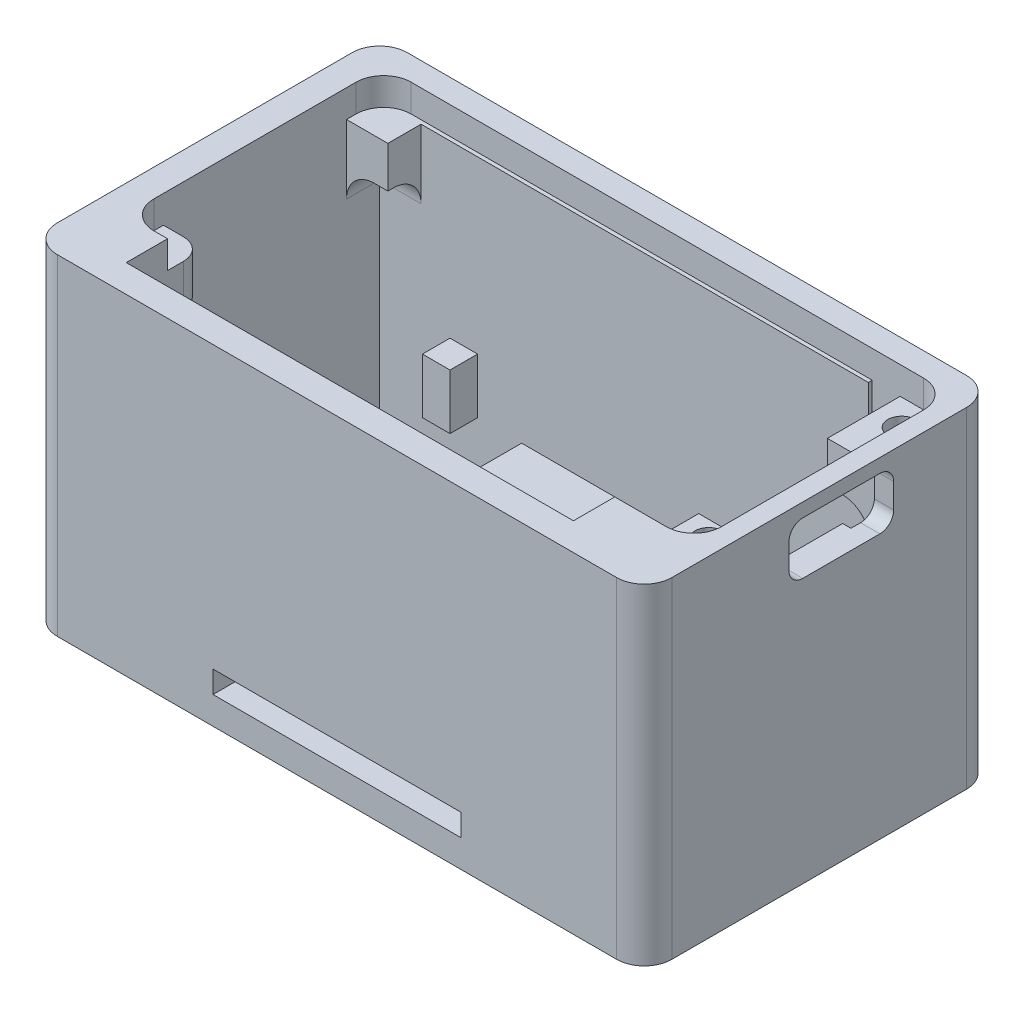
from build123d import *

# Parameters (mm, degrees)
SKETCH1_W           = 56.642
SKETCH1_H           = 32.258
BOSS_EXTRUDE1_DEPTH = 30.48
SHELL1_T            = -2.54
BOSS_EXTRUDE2_DEPTH = 6.35
FILLET2_R           = 2.54
FILLET3_R           = 2.54
CUT_EXTRUDE9_REACH  = 54.647
SKETCH10_W          = 22.86
SKETCH10_H          = 2.032
BOSS_EXTRUDE3_REACH = 46.623
SKETCH13_W          = 2.54
SKETCH13_H          = 3.81
SKETCH14_W          = 3.81
SKETCH14_H          = 1.27
BOSS_EXTRUDE4_DEPTH = 25.4
CUT_EXTRUDE10_DEPTH = 2.54
CUT_EXTRUDE11_REACH = 46.623
SKETCH16_W          = 9.652
SKETCH16_H          = 4.826
SKETCH11_R          = 1.27
CUT_EXTRUDE12_DEPTH = 9.398
MIRROR2_START       = 4.572
MIRROR2_OUTLINE_W   = 25.4
MIRROR2_OUTLINE_H   = 3.81
MIRROR2_DEPTH       = 2.54
SKETCH17_W          = 2.54
SKETCH17_H          = 3.81
CUT_EXTRUDE13_DEPTH = 23.368
SKETCH18_W          = 7.2898
SKETCH18_H          = 2.54
CUT_EXTRUDE14_DEPTH = 7.366
FILLET4_R           = 1.27
SKETCH19_W          = 2.54
SKETCH19_H          = 5.08
BOSS_EXTRUDE5_DEPTH = 2.54
CUT_EXTRUDE15_START = -23.368
SKETCH20_W          = 2.54
SKETCH20_H          = 3.81
CUT_EXTRUDE15_DEPTH = 23.368
SKETCH22_W          = 2.657331224
SKETCH22_H          = 5.08
CUT_EXTRUDE18_DEPTH = 6.858
SKETCH23_W          = 2.581688451
SKETCH23_H          = 6.7056
CUT_EXTRUDE19_DEPTH = 6.858
SKETCH24_W          = 4.254264989
SKETCH24_H          = 4.461970644
CUT_EXTRUDE20_DEPTH = 7.112


# Read off the part's stored shape, not the designer's step: Mirror2
with BuildPart() as part:
    # Sketch1 → Boss-Extrude1 (new body)
    with BuildSketch(Plane(origin=(0, 0, 0), x_dir=(1, 0, 0), z_dir=(0, 1, 0))):
        Rectangle(SKETCH1_W, SKETCH1_H)
    extrude(amount=BOSS_EXTRUDE1_DEPTH)

    # Shell1
    shell1_openings = [part.faces().sort_by_distance(p)[0] for p in [
        (0, 30.48, 0),
    ]]
    offset(amount=SHELL1_T, openings=shell1_openings, kind=Kind.INTERSECTION)

    # Sketch3 → Boss-Extrude2 (add)
    with BuildSketch(Plane(origin=(0, 30.48, 0), x_dir=(1, 0, 0), z_dir=(0, 1, 0))):
        with BuildLine():
            Line((-25.781, 13.589), (-25.781, 6.35))
            Line((-25.781, 6.35), (-23.9268, 6.35))
            ThreePointArc((-23.9268, 6.35), (-22.543840557, 6.922840557), (-21.971, 8.3058))
            Line((-21.971, 8.3058), (-21.971, 13.589))
            Line((-21.971, 13.589), (-25.781, 13.589))
        make_face()
        with BuildLine():
            Line((-21.971, -13.589), (-21.971, -8.3058))
            ThreePointArc((-21.971, -8.3058), (-22.543840557, -6.922840557), (-23.9268, -6.35))
            Line((-23.9268, -6.35), (-25.781, -6.35))
            Line((-25.781, -6.35), (-25.781, -13.589))
            Line((-25.781, -13.589), (-21.971, -13.589))
        make_face()
        with BuildLine():
            Line((25.781, 13.589), (19.2532, 13.589))
            Line((19.2532, 13.589), (19.2532, 5.969))
            ThreePointArc((19.2532, 5.969), (19.625174388, 5.070974388), (20.5232, 4.699))
            Line((20.5232, 4.699), (25.781, 4.699))
            Line((25.781, 4.699), (25.781, 13.589))
        make_face()
        with BuildLine():
            Line((25.781, -4.699), (25.781, -13.589))
            Line((25.781, -13.589), (19.2532, -13.589))
            Line((19.2532, -13.589), (19.2532, -5.969))
            ThreePointArc((19.2532, -5.969), (19.625174388, -5.070974388), (20.5232, -4.699))
            Line((20.5232, -4.699), (25.781, -4.699))
        make_face()
    extrude(amount=-BOSS_EXTRUDE2_DEPTH)

    # Fillet2
    fillet2_edges = [part.edges().sort_by_distance(p)[0] for p in [
        (28.321, 15.24, 16.129),
        (-28.321, 15.24, 16.129),
        (-28.321, 15.24, -16.129),
        (28.321, 15.24, -16.129),
    ]]
    fillet(fillet2_edges, radius=FILLET2_R)

    # Fillet3
    fillet3_edges = [part.edges().sort_by_distance(p)[0] for p in [
        (-25.781, 24.13, 9.9695),
        (-23.876, 24.13, 13.589),
        (22.5171, 24.13, 13.589),
        (25.781, 24.13, 9.144),
        (-23.876, 24.13, -13.589),
        (-25.781, 24.13, -9.9695),
        (22.5171, 24.13, -13.589),
        (25.781, 24.13, -9.144),
    ]]
    fillet(fillet3_edges, radius=FILLET3_R)

    # Cut-Extrude9: up to this face of the body (flat: up to its plane)
    cut_extrude9_end = Plane(part.part.faces().sort_by_distance((0, 15.24, 16.129))[0])
    # Sketch10 → Cut-Extrude9 (cut, up to the picked face)
    with BuildSketch(Plane(origin=(0, 0, -16.129), x_dir=(-1, 0, 0), z_dir=(0, 0, -1)), mode=Mode.PRIVATE) as cut_extrude9_sk1:
        with Locations((0, 3.556)):
            Rectangle(SKETCH10_W, SKETCH10_H)
    cut_extrude9_tool1 = split(extrude(cut_extrude9_sk1.sketch, amount=-CUT_EXTRUDE9_REACH, mode=Mode.PRIVATE), bisect_by=cut_extrude9_end, keep=Keep.BOTH, mode=Mode.PRIVATE)
    add(cut_extrude9_tool1.solids().sort_by(Axis((0, 3.556, -16.129), (0, 0, 1)))[0], mode=Mode.SUBTRACT)

    # Sketch13 → Boss-Extrude3 (add, up to next)
    with BuildSketch(Plane(origin=(0, 30.48, 0), x_dir=(1, 0, 0), z_dir=(0, 1, 0)), mode=Mode.PRIVATE) as boss_extrude3_sk1:
        with Locations((-13.97, -11.684)):
            Rectangle(SKETCH13_W, SKETCH13_H)
    boss_extrude3_tool1 = extrude(boss_extrude3_sk1.sketch, amount=-BOSS_EXTRUDE3_REACH, mode=Mode.PRIVATE) - part.part
    boss_extrude3 = boss_extrude3_tool1.solids().sort_by_distance((-13.97, 30.48, 11.684))[0]
    add(boss_extrude3)

    # Mirror1: Boss-Extrude3 across plane
    add(boss_extrude3.mirror(Plane(origin=(0, 0, 0), x_dir=(0, 0, 1), z_dir=(1, 0, 0))))

    # Sketch14 → Boss-Extrude4 (add)
    with BuildSketch(Plane.ZY.offset(-12.7)):
        with Locations((11.684, 5.207)):
            Rectangle(SKETCH14_W, SKETCH14_H)
    extrude(amount=BOSS_EXTRUDE4_DEPTH)

    # Sketch15 → Cut-Extrude10 (cut)
    with BuildSketch(Plane(origin=(0, 30.48, 0), x_dir=(1, 0, 0), z_dir=(0, 1, 0))):
        with BuildLine():
            Line((-25.781, 11.4046), (-25.781, 6.35))
            Line((-25.781, 6.35), (-23.9268, 6.35))
            ThreePointArc((-23.9268, 6.35), (-22.543840557, 6.922840557), (-21.971, 8.3058))
            Line((-21.971, 8.3058), (-21.971, 13.589))
            Line((-21.971, 13.589), (19.2532, 13.589))
            Line((19.2532, 13.589), (19.2532, 5.969))
            ThreePointArc((19.2532, 5.969), (19.625174388, 5.070974388), (20.5232, 4.699))
            Line((20.5232, 4.699), (25.781, 4.699))
            Line((25.781, 4.699), (25.781, -4.699))
            Line((25.781, -4.699), (20.5232, -4.699))
            ThreePointArc((20.5232, -4.699), (19.625174388, -5.070974388), (19.2532, -5.969))
            Line((19.2532, -5.969), (19.2532, -9.779))
            Line((19.2532, -9.779), (24.003, -9.779))
            ThreePointArc((24.003, -9.779), (25.799051224, -9.035051224), (26.543, -7.239))
            Line((26.543, -7.239), (26.543, -1.000588636))
            Line((26.543, -1.000588636), (26.543, 5.166188636))
            Line((26.543, 5.166188636), (26.543, 11.4046))
            ThreePointArc((26.543, 11.4046), (25.799051224, 13.200651224), (24.003, 13.9446))
            Line((24.003, 13.9446), (-23.241, 13.9446))
            ThreePointArc((-23.241, 13.9446), (-25.037051224, 13.200651224), (-25.781, 11.4046))
        make_face()
        with BuildLine():
            Line((-25.781, -6.35), (-25.781, -7.239))
            ThreePointArc((-25.781, -7.239), (-25.037051224, -9.035051224), (-23.241, -9.779))
            Line((-23.241, -9.779), (-21.971, -9.779))
            Line((-21.971, -9.779), (-21.971, -8.3058))
            ThreePointArc((-21.971, -8.3058), (-22.543840557, -6.922840557), (-23.9268, -6.35))
            Line((-23.9268, -6.35), (-25.781, -6.35))
        make_face()
    extrude(amount=-CUT_EXTRUDE10_DEPTH, mode=Mode.SUBTRACT)

    # Cut-Extrude11: up to this face of the body (flat: up to its plane)
    cut_extrude11_end = Plane(part.part.faces().sort_by_distance((28.321, 15.24, 0))[0])
    # Sketch16 → Cut-Extrude11 (cut, up to the picked face)
    with BuildSketch(Plane(origin=(0, 0, 0), x_dir=(0, 0, -1), z_dir=(1, 0, 0)), mode=Mode.PRIVATE) as cut_extrude11_sk1:
        with Locations((2.032, 26.797)):
            Rectangle(SKETCH16_W, SKETCH16_H)
    cut_extrude11_tool1 = split(extrude(cut_extrude11_sk1.sketch, amount=CUT_EXTRUDE11_REACH, mode=Mode.PRIVATE), bisect_by=cut_extrude11_end, keep=Keep.BOTH, mode=Mode.PRIVATE)
    add(cut_extrude11_tool1.solids().sort_by(Axis((0, 26.797, -2.032), (1, 0, 0)))[0], mode=Mode.SUBTRACT)

    # Sketch11 → Cut-Extrude12 (cut)
    with BuildSketch(Plane(origin=(0, 30.48, 0), x_dir=(1, 0, 0), z_dir=(0, 1, 0))):
        with Locations(Location((24.384, 11.5316, 0), (0, 0, 270))):
            Circle(SKETCH11_R)
        with Locations(Location((24.384, -6.2484, 0), (0, 0, 270))):
            Circle(SKETCH11_R)
    extrude(amount=-CUT_EXTRUDE12_DEPTH, mode=Mode.SUBTRACT)

    # Mirror2 outline → Mirror2 (add)
    with BuildSketch(Plane(origin=(0, 0, 0), x_dir=(1, 0, 0), z_dir=(0, 1, 0)).offset(MIRROR2_START)):
        with Locations((0, 11.684)):
            Rectangle(MIRROR2_OUTLINE_W, MIRROR2_OUTLINE_H)
        with Locations((0, -11.684)):
            Rectangle(MIRROR2_OUTLINE_W, MIRROR2_OUTLINE_H)
    extrude(amount=MIRROR2_DEPTH)

    # Sketch17 → Cut-Extrude13 (cut)
    with BuildSketch(Plane(origin=(0, 30.48, 0), x_dir=(1, 0, 0), z_dir=(0, 1, 0))):
        with Locations((-13.97, -11.684)):
            Rectangle(SKETCH17_W, SKETCH17_H)
    extrude(amount=-CUT_EXTRUDE13_DEPTH, mode=Mode.SUBTRACT)

    # Sketch18 → Cut-Extrude14 (cut)
    with BuildSketch(Plane(origin=(0, 27.94, 0), x_dir=(1, 0, 0), z_dir=(0, 1, 0))):
        with Locations((22.8981, 5.969)):
            Rectangle(SKETCH18_W, SKETCH18_H)
    extrude(amount=-CUT_EXTRUDE14_DEPTH, mode=Mode.SUBTRACT)

    # Fillet4
    fillet4_edges = [part.edges().sort_by_distance(p)[0] for p in [
        (27.432, 29.21, -6.858),
        (27.432, 24.384, -6.858),
        (27.051, 24.384, 2.794),
        (27.432, 29.21, 2.794),
    ]]
    fillet(fillet4_edges, radius=FILLET4_R)

    # Sketch19 → Boss-Extrude5 (add)
    with BuildSketch(Plane(origin=(0, 0, 13.589), x_dir=(-1, 0, 0), z_dir=(0, 0, -1))):
        with Locations((18.034, 9.652)):
            Rectangle(SKETCH19_W, SKETCH19_H)
    boss_extrude5 = extrude(amount=BOSS_EXTRUDE5_DEPTH)

    # Mirror3: Boss-Extrude5 across plane
    add(boss_extrude5.mirror(Plane.XY))

    # Sketch20 → Cut-Extrude15 (cut)
    with BuildSketch(Plane(origin=(0, 30.48, 0), x_dir=(1, 0, 0), z_dir=(0, 1, 0)).offset(CUT_EXTRUDE15_START)):
        with Locations((13.97, -11.684)):
            Rectangle(SKETCH20_W, SKETCH20_H)
    extrude(amount=CUT_EXTRUDE15_DEPTH, mode=Mode.SUBTRACT)

    # Sketch22 → Cut-Extrude18 (cut)
    with BuildSketch(Plane(origin=(0, 27.94, 0), x_dir=(1, 0, 0), z_dir=(0, 1, 0))):
        with Locations((20.581865612, -7.239)):
            Rectangle(SKETCH22_W, SKETCH22_H)
    extrude(amount=-CUT_EXTRUDE18_DEPTH, mode=Mode.SUBTRACT)

    # Sketch23 → Cut-Extrude19 (cut)
    with BuildSketch(Plane(origin=(0, 27.94, 0), x_dir=(1, 0, 0), z_dir=(0, 1, 0))):
        with Locations((20.544044226, 10.5918)):
            Rectangle(SKETCH23_W, SKETCH23_H)
    extrude(amount=-CUT_EXTRUDE19_DEPTH, mode=Mode.SUBTRACT)

    # Sketch24 → Cut-Extrude20 (cut)
    with BuildSketch(Plane(origin=(0, 27.94, 0), x_dir=(1, 0, 0), z_dir=(0, 1, 0))):
        with Locations((-23.653867506, 8.297478086)):
            Rectangle(SKETCH24_W, SKETCH24_H)
    extrude(amount=-CUT_EXTRUDE20_DEPTH, mode=Mode.SUBTRACT)


solid = part.part
